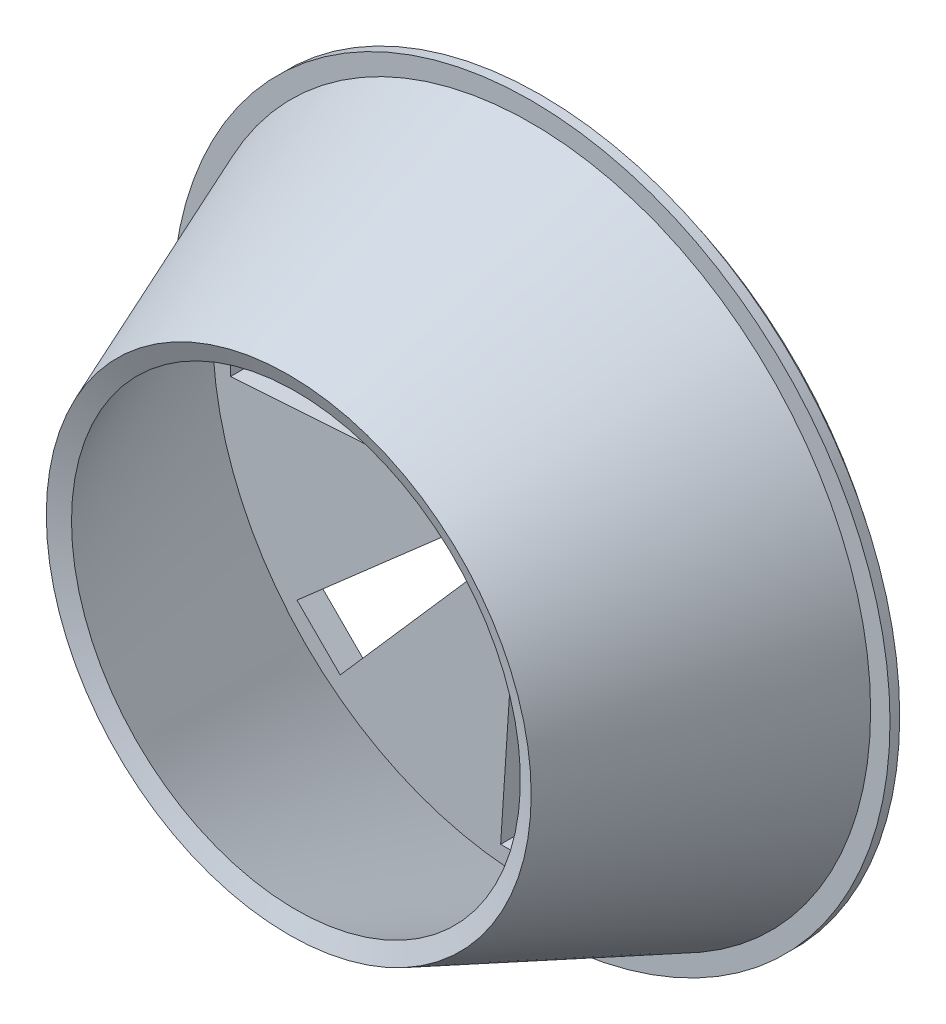
from build123d import *

# Parameters (mm, degrees)
BOSS_EXTRUDE1_OUTLINE_R = 35
BOSS_EXTRUDE1_DEPTH     = 2.5
THICKEN1_T2             = 2
SKETCH7_R               = 37
SKETCH7_R_2             = 33.5
BOSS_EXTRUDE2_DEPTH     = 1


# Read off the part's stored shape, not the designer's step: Boss-Extrude1
with BuildPart() as part:
    # Boss-Extrude1 outline → Boss-Extrude1 (new body)
    with BuildSketch(Plane.XY):
        Circle(BOSS_EXTRUDE1_OUTLINE_R)
        Polygon((-3.181980515, -5.303300859), (-19.692923856, -24.147696578), (-24.147696578, -19.692923856), (-5.303300859, -3.181980515), align=None, mode=Mode.SUBTRACT)
        Polygon((1.5, -6), (3.15, -31), (-3.15, -31), (-1.5, -6), align=None, mode=Mode.SUBTRACT)
        Polygon((5.303300859, -3.181980515), (24.147696578, -19.692923856), (19.692923856, -24.147696578), (3.181980515, -5.303300859), align=None, mode=Mode.SUBTRACT)
        Polygon((-6, -1.5), (-31, -3.15), (-31, 3.15), (-6, 1.5), align=None, mode=Mode.SUBTRACT)
        Polygon((-5.303300859, 3.181980515), (-24.147696578, 19.692923856), (-19.692923856, 24.147696578), (-3.181980515, 5.303300859), align=None, mode=Mode.SUBTRACT)
        Polygon((3.181980515, 5.303300859), (19.692923856, 24.147696578), (24.147696578, 19.692923856), (5.303300859, 3.181980515), align=None, mode=Mode.SUBTRACT)
        Polygon((6, 1.5), (31, 3.15), (31, -3.15), (6, -1.5), align=None, mode=Mode.SUBTRACT)
        Polygon((1.5, 6), (-1.5, 6), (-3.15, 31), (3.15, 31), align=None, mode=Mode.SUBTRACT)
    extrude(amount=BOSS_EXTRUDE1_DEPTH)

    # Surface-Loft3: a surface lofted through 2 sketches
    with BuildLine(Plane.XY.offset(2.5), mode=Mode.PRIVATE) as surface_loft3_1_s0:
        CenterArc((0, 0), 35, 0, 360)
    with BuildLine(Plane.XY.offset(27.5), mode=Mode.PRIVATE) as surface_loft3_1_s1:
        CenterArc((0, 0), 25, 0, 360)
    surface_loft3_1 = Shell.make_loft([surface_loft3_1_s0.wire(), surface_loft3_1_s1.wire()])
    add(Solid.thicken(surface_loft3_1, -THICKEN1_T2))

    # Sketch7 → Boss-Extrude2 (add)
    with BuildSketch(Plane(origin=(0, 0, 2.5), x_dir=(-1, 0, 0), z_dir=(0, 0, -1))):
        Circle(SKETCH7_R)
        Circle(SKETCH7_R_2, mode=Mode.SUBTRACT)
    extrude(amount=BOSS_EXTRUDE2_DEPTH)


solid = part.part
